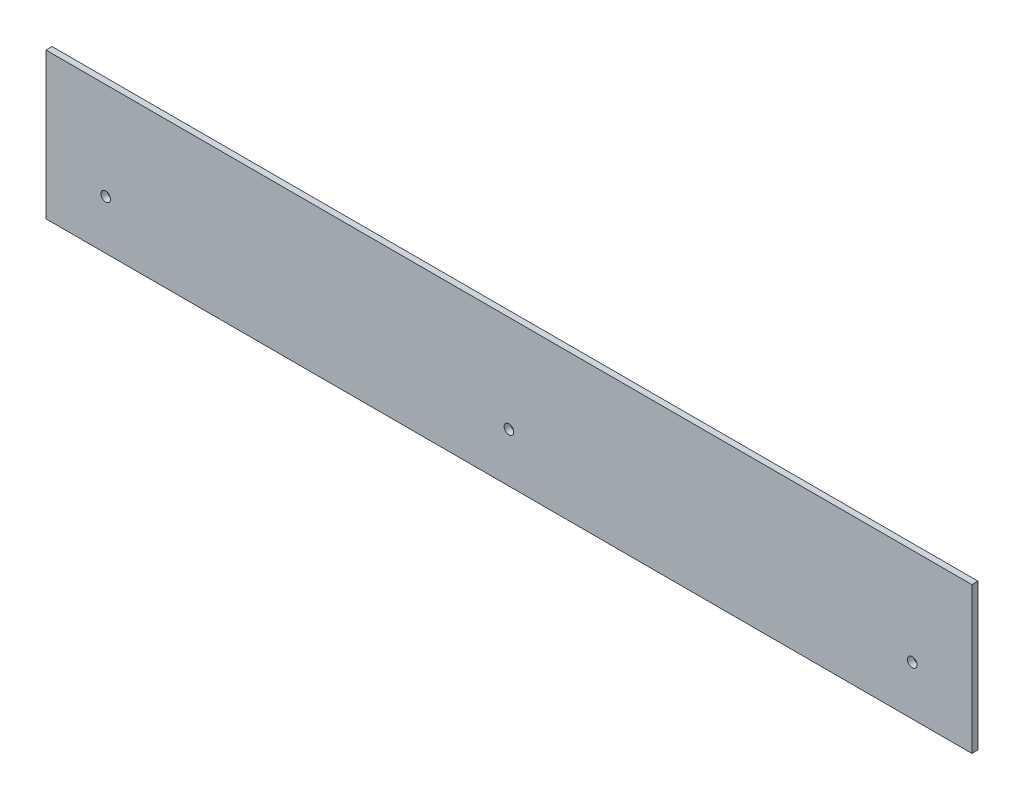
from build123d import *

# Parameters (mm, degrees)
SKETCH1_W           = 482.6
SKETCH1_H           = 76.2
BOSS_EXTRUDE1_DEPTH = 3.175
SKETCH2_R           = 2.5
CUT_EXTRUDE1_DEPTH  = 245.310009261


with BuildPart() as part:
    # Sketch1 → Boss-Extrude1 (new body)
    with BuildSketch(Plane.XY):
        Rectangle(SKETCH1_W, SKETCH1_H)
    extrude(amount=BOSS_EXTRUDE1_DEPTH)

    # Sketch2 → Cut-Extrude1 (cut, through all)
    with BuildSketch(Plane.XY.offset(3.175)):
        with Locations((-210.185, -12.446)):
            Circle(SKETCH2_R)
        with Locations((210.185, -12.446)):
            Circle(SKETCH2_R)
        with Locations((0, -12.446)):
            Circle(SKETCH2_R)
    extrude(amount=-CUT_EXTRUDE1_DEPTH, mode=Mode.SUBTRACT)


solid = part.part
